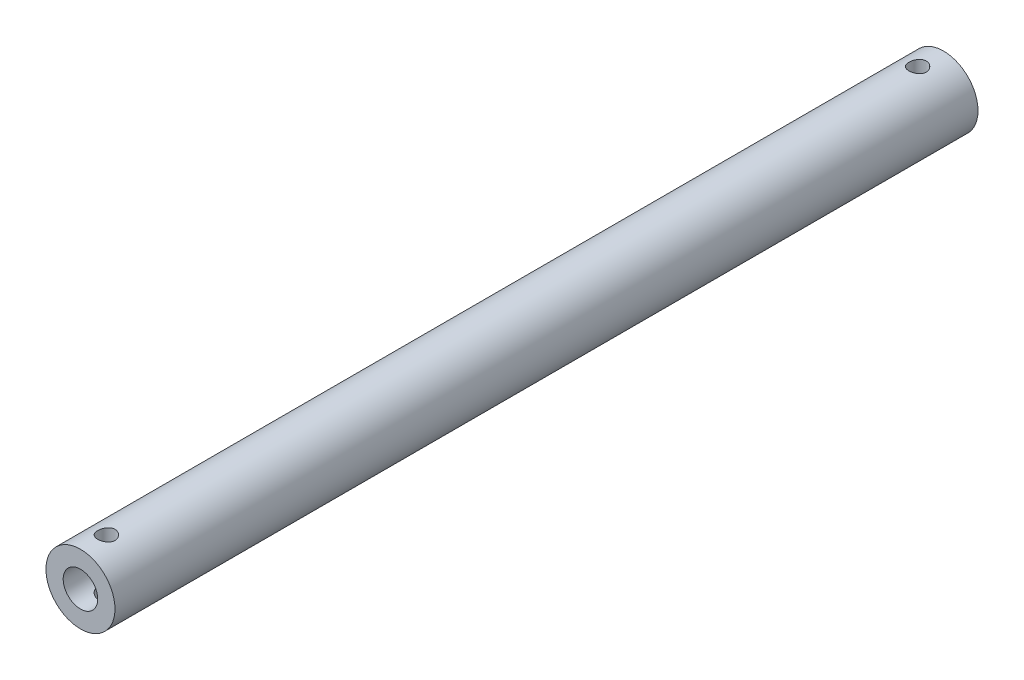
from build123d import *

# Parameters (mm, degrees)
ESQUISSE1_R             = 4
ESQUISSE1_R_2           = 2
BOSS_EXTRU_1_DEPTH      = 100
ESQUISSE2_R             = 1
ENL_V_MAT_EXTRU_1_DEPTH = 101.715111652


with BuildPart() as part:
    # Esquisse1 → Boss.-Extru.1 (new body)
    with BuildSketch(Plane.XY):
        with Locations((-4.918167702, 1.104491281)):
            Circle(ESQUISSE1_R)
        with Locations((-4.918167702, 1.104491281)):
            Circle(ESQUISSE1_R_2, mode=Mode.SUBTRACT)
    extrude(amount=BOSS_EXTRU_1_DEPTH)

    # Esquisse2 → Enlèv. mat.-Extru.1 (cut, through all)
    with BuildSketch(Plane(origin=(0, 5.104491281, 0), x_dir=(1, 0, 0), z_dir=(0, 1, 0))):
        with Locations((-4.918167702, -3)):
            Circle(ESQUISSE2_R)
        with Locations((-4.918167702, -97)):
            Circle(ESQUISSE2_R)
    extrude(amount=-ENL_V_MAT_EXTRU_1_DEPTH, mode=Mode.SUBTRACT)


solid = part.part
